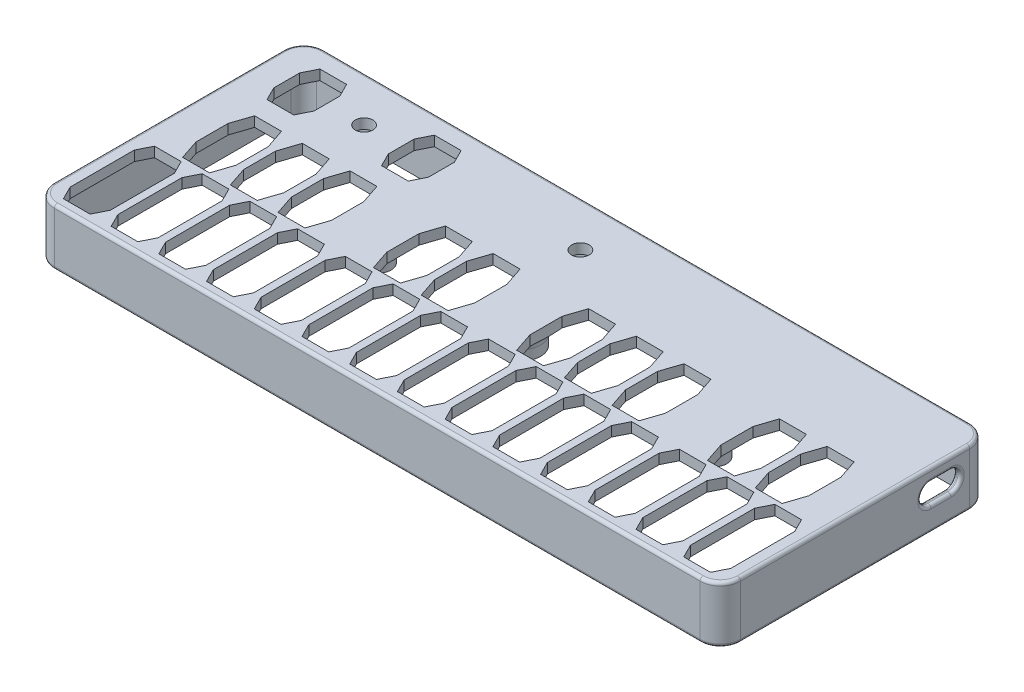
from build123d import *

# Parameters (mm, degrees)
SKETCH1_W           = 267.97
SKETCH1_H           = 101.6
BOSS_EXTRUDE1_DEPTH = 4
SKETCH3_R           = 3.5
CUT_EXTRUDE2_DEPTH  = 4
FILLET1_R           = 5.08
SKETCH4_R           = 5.08
SKETCH4_R_2         = 1.27
SKETCH4_R_3         = 7.62
BOSS_EXTRUDE2_DEPTH = 9
FILLET2_R           = 5.08
BOSS_EXTRUDE3_DEPTH = 22.606
FILLET3_R           = 1.27
USB_HOLE_DEPTH      = 22.606
FILLET4_R           = 1.27


with BuildPart() as part:
    # Sketch1 → Boss-Extrude1 (new body)
    with BuildSketch(Plane(origin=(0, 0, 0), x_dir=(1, 0, 0), z_dir=(0, 1, 0))):
        Rectangle(SKETCH1_W, SKETCH1_H)
    extrude(amount=BOSS_EXTRUDE1_DEPTH)

    # Sketch3 → Cut-Extrude2 (cut)
    with BuildSketch(Plane(origin=(-72.682254047, 4, -171.677206238), x_dir=(1, 0, 0), z_dir=(0, 1, 0))):
        Polygon((-14.550168649, -175.551724153), (-14.550168649, -162.722688324), (-17.201188446, -154.769628934), (-27.934303461, -154.769628934), (-30.585323258, -162.722688324), (-30.585323258, -175.551724153), (-27.934303461, -183.504783543), (-17.201188446, -183.504783543), align=None)
        Polygon((-24.075168649, -216.221061509), (-24.075168649, -190.633350968), (-26.767029666, -185.249628934), (-37.418462241, -185.249628934), (-40.110323258, -190.633350968), (-40.110323258, -216.221061509), (-37.418462241, -221.604783543), (-26.767029666, -221.604783543), align=None)
        Polygon((-56.468462241, -185.249628934), (-59.160323258, -190.633350968), (-59.160323258, -216.221061509), (-56.468462241, -221.604783543), (-45.817029666, -221.604783543), (-43.125168649, -216.221061509), (-43.125168649, -190.633350968), (-45.817029666, -185.249628934), align=None)
        Polygon((-5.025168649, -216.221061509), (-5.025168649, -190.633350968), (-7.717029666, -185.249628934), (-18.368462241, -185.249628934), (-21.060323258, -190.633350968), (-21.060323258, -216.221061509), (-18.368462241, -221.604783543), (-7.717029666, -221.604783543), align=None)
        Polygon((14.024831351, -216.221061509), (14.024831351, -190.633350968), (11.332970334, -185.249628934), (0.681537759, -185.249628934), (-2.010323258, -190.633350968), (-2.010323258, -216.221061509), (0.681537759, -221.604783543), (11.332970334, -221.604783543), align=None)
        Polygon((33.074831351, -216.221061509), (33.074831351, -190.633350968), (30.382970334, -185.249628934), (19.731537759, -185.249628934), (17.039676742, -190.633350968), (17.039676742, -216.221061509), (19.731537759, -221.604783543), (30.382970334, -221.604783543), align=None)
        Polygon((52.124831351, -216.221061509), (52.124831351, -190.633350968), (49.432970334, -185.249628934), (38.781537759, -185.249628934), (36.089676742, -190.633350968), (36.089676742, -216.221061509), (38.781537759, -221.604783543), (49.432970334, -221.604783543), align=None)
        Polygon((71.174831351, -216.221061509), (71.174831351, -190.633350968), (68.482970334, -185.249628934), (57.831537759, -185.249628934), (55.139676742, -190.633350968), (55.139676742, -216.221061509), (57.831537759, -221.604783543), (68.482970334, -221.604783543), align=None)
        Polygon((90.224831351, -216.221061509), (90.224831351, -190.633350968), (87.532970334, -185.249628934), (76.881537759, -185.249628934), (74.189676742, -190.633350968), (74.189676742, -216.221061509), (76.881537759, -221.604783543), (87.532970334, -221.604783543), align=None)
        Polygon((109.274831351, -216.221061509), (109.274831351, -190.633350968), (106.582970334, -185.249628934), (95.931537759, -185.249628934), (93.239676742, -190.633350968), (93.239676742, -216.221061509), (95.931537759, -221.604783543), (106.582970334, -221.604783543), align=None)
        Polygon((128.324831351, -216.221061509), (128.324831351, -190.633350968), (125.632970334, -185.249628934), (114.981537759, -185.249628934), (112.289676742, -190.633350968), (112.289676742, -216.221061509), (114.981537759, -221.604783543), (125.632970334, -221.604783543), align=None)
        Polygon((147.374831351, -216.221061509), (147.374831351, -190.633350968), (144.682970334, -185.249628934), (134.031537759, -185.249628934), (131.339676742, -190.633350968), (131.339676742, -216.221061509), (134.031537759, -221.604783543), (144.682970334, -221.604783543), align=None)
        Polygon((166.424831351, -216.221061509), (166.424831351, -190.633350968), (163.732970334, -185.249628934), (153.081537759, -185.249628934), (150.389676742, -190.633350968), (150.389676742, -216.221061509), (153.081537759, -221.604783543), (163.732970334, -221.604783543), align=None)
        Polygon((185.474831351, -216.221061509), (185.474831351, -190.633350968), (182.782970334, -185.249628934), (172.131537759, -185.249628934), (169.439676742, -190.633350968), (169.439676742, -216.221061509), (172.131537759, -221.604783543), (182.782970334, -221.604783543), align=None)
        Polygon((204.524831351, -216.221061509), (204.524831351, -190.633350968), (201.832970334, -185.249628934), (191.181537759, -185.249628934), (188.489676742, -190.633350968), (188.489676742, -216.221061509), (191.181537759, -221.604783543), (201.832970334, -221.604783543), align=None)
        Polygon((-36.251188446, -183.504783543), (-33.600168649, -175.551724153), (-33.600168649, -162.722688324), (-36.251188446, -154.769628934), (-46.984303461, -154.769628934), (-49.635323258, -162.722688324), (-49.635323258, -175.551724153), (-46.984303461, -183.504783543), align=None)
        Polygon((4.499831351, -175.551724153), (4.499831351, -162.722688324), (1.848811554, -154.769628934), (-8.884303461, -154.769628934), (-11.535323258, -162.722688324), (-11.535323258, -175.551724153), (-8.884303461, -183.504783543), (1.848811554, -183.504783543), align=None)
        Polygon((42.599831351, -175.551724153), (42.599831351, -162.722688324), (39.948811554, -154.769628934), (29.215696539, -154.769628934), (26.564676742, -162.722688324), (26.564676742, -175.551724153), (29.215696539, -183.504783543), (39.948811554, -183.504783543), align=None)
        Polygon((61.649831351, -175.551724153), (61.649831351, -162.722688324), (58.998811554, -154.769628934), (48.265696539, -154.769628934), (45.614676742, -162.722688324), (45.614676742, -175.551724153), (48.265696539, -183.504783543), (58.998811554, -183.504783543), align=None)
        Polygon((-39.467029666, -146.674783543), (-36.775168649, -141.291061509), (-36.775168649, -130.943350968), (-39.467029666, -125.559628934), (-50.118462241, -125.559628934), (-52.810323258, -130.943350968), (-52.810323258, -141.291061509), (-50.118462241, -146.674783543), align=None)
        Polygon((6.252970334, -146.674783543), (8.944831351, -141.291061509), (8.944831351, -130.943350968), (6.252970334, -125.559628934), (-4.398462241, -125.559628934), (-7.090323258, -130.943350968), (-7.090323258, -141.291061509), (-4.398462241, -146.674783543), align=None)
        Polygon((99.749831351, -175.551724153), (99.749831351, -162.722688324), (97.098811554, -154.769628934), (86.365696539, -154.769628934), (83.714676742, -162.722688324), (83.714676742, -175.551724153), (86.365696539, -183.504783543), (97.098811554, -183.504783543), align=None)
        Polygon((118.799831351, -175.551724153), (118.799831351, -162.722688324), (116.148811554, -154.769628934), (105.415696539, -154.769628934), (102.764676742, -162.722688324), (102.764676742, -175.551724153), (105.415696539, -183.504783543), (116.148811554, -183.504783543), align=None)
        Polygon((137.849831351, -175.551724153), (137.849831351, -162.722688324), (135.198811554, -154.769628934), (124.465696539, -154.769628934), (121.814676742, -162.722688324), (121.814676742, -175.551724153), (124.465696539, -183.504783543), (135.198811554, -183.504783543), align=None)
        Polygon((175.949831351, -175.551724153), (175.949831351, -162.722688324), (173.298811554, -154.769628934), (162.565696539, -154.769628934), (159.914676742, -162.722688324), (159.914676742, -175.551724153), (162.565696539, -183.504783543), (173.298811554, -183.504783543), align=None)
        Polygon((194.999831351, -175.551724153), (194.999831351, -162.722688324), (192.348811554, -154.769628934), (181.615696539, -154.769628934), (178.964676742, -162.722688324), (178.964676742, -175.551724153), (181.615696539, -183.504783543), (192.348811554, -183.504783543), align=None)
        with Locations(Location((64.427254047, -136.117206238, 0), (0, 0, 270))):
            Circle(SKETCH3_R)
        with Locations(Location((-21.932745953, -136.117206238, 0), (0, 0, 270))):
            Circle(SKETCH3_R)
    extrude(amount=-CUT_EXTRUDE2_DEPTH, mode=Mode.SUBTRACT)

    # Fillet1
    fillet1_edges = [part.edges().sort_by_distance(p)[0] for p in [
        (133.985, 2, 50.8),
        (-133.985, 2, 50.8),
        (-133.985, 2, -50.8),
        (133.985, 2, -50.8),
    ]]
    fillet(fillet1_edges, radius=FILLET1_R)

    # Sketch4 → Boss-Extrude2 (add)
    # profile 1 of 3: a face of its own
    with BuildSketch(Plane(origin=(0, 0, 0), x_dir=(-1, 0, 0), z_dir=(0, -1, 0))):
        with Locations(Location((57.15, 3.81, 0), (0, 0, 270))):
            Circle(SKETCH4_R)
        with Locations(Location((57.15, 3.81, 0), (0, 0, 90))):
            Circle(SKETCH4_R_2, mode=Mode.SUBTRACT)
    # profile 2 of 3: a face of its own
    with BuildSketch(Plane(origin=(0, 0, 0), x_dir=(-1, 0, 0), z_dir=(0, -1, 0))):
        with Locations(Location((-76.835, 3.81, 0), (0, 0, 270))):
            Circle(SKETCH4_R)
        with Locations(Location((-76.835, 3.81, 0), (0, 0, 90))):
            Circle(SKETCH4_R_2, mode=Mode.SUBTRACT)
    # profile 3 of 3: a face of its own
    with BuildSketch(Plane(origin=(0, 0, 0), x_dir=(-1, 0, 0), z_dir=(0, -1, 0))):
        with Locations(Location((0, 3.81, 0), (0, 0, 270))):
            Circle(SKETCH4_R_3)
    extrude(amount=BOSS_EXTRUDE2_DEPTH)

    # Fillet2
    # the kernel refuses this fillet: 5.08 mm, written as the material it adds along each edge
    with BuildSketch(Plane(origin=(-57.15, 0, -3.81), x_dir=(0, 0, 1), z_dir=(1, 0, 0))) as fillet2_piece_1:
        with BuildLine():
            CenterArc((5.08 + FILLET2_R, FILLET2_R), FILLET2_R, 180, 90)
            Line((5.08, FILLET2_R), (5.08, 0))
            Line((5.08, 0), (5.08 + FILLET2_R, 0))
        make_face()
    revolve(axis=Axis((-57.15, 0, -3.81), (0, -1, 0)))
    with BuildSketch(Plane(origin=(76.835, 0, -3.81), x_dir=(0, 0, 1), z_dir=(1, 0, 0))) as fillet2_piece_2:
        with BuildLine():
            CenterArc((5.08 + FILLET2_R, FILLET2_R), FILLET2_R, 180, 90)
            Line((5.08, FILLET2_R), (5.08, 0))
            Line((5.08, 0), (5.08 + FILLET2_R, 0))
        make_face()
    revolve(axis=Axis((76.835, 0, -3.81), (0, -1, 0)))
    with BuildSketch(Plane(origin=(0, 0, -3.81), x_dir=(0, 0, 1), z_dir=(1, 0, 0))) as fillet2_piece_3_section:
        with BuildLine():
            CenterArc((7.62 + FILLET2_R, FILLET2_R), FILLET2_R, 180, 90)
            Line((7.62, FILLET2_R), (7.62, 0))
            Line((7.62, 0), (7.62 + FILLET2_R, 0))
        make_face()
    fillet2_piece_3 = revolve(axis=Axis((0, 0, -3.81), (0, -1, 0)), mode=Mode.PRIVATE)
    fillet2_piece_3 = split(fillet2_piece_3, bisect_by=Plane(origin=(11.032422696, -1.439568493, -12.869568493), z_dir=(-1, 0, 0)), keep=Keep.TOP, mode=Mode.PRIVATE)
    fillet2_piece_3 = split(fillet2_piece_3, bisect_by=Plane(origin=(11.1036956, -1.439568493, -9.168336627), z_dir=(-0.9486832980505142, -1.1041033438718387e-15, -0.31622776601683694)), keep=Keep.TOP, mode=Mode.PRIVATE)
    fillet2_piece_3 = split(fillet2_piece_3, bisect_by=Plane(origin=(-11.032422696, -1.439568493, -12.869568493), z_dir=(1, 0, 0)), keep=Keep.TOP, mode=Mode.PRIVATE)
    fillet2_piece_3 = split(fillet2_piece_3, bisect_by=Plane(origin=(-11.1036956, -1.439568493, -9.168336627), z_dir=(0.9486832980505139, -1.1041033438718415e-15, -0.31622776601683766)), keep=Keep.TOP, mode=Mode.PRIVATE)
    add(fillet2_piece_3)
    with BuildSketch(Plane(origin=(0, 0, -3.81), x_dir=(0, 0, 1), z_dir=(1, 0, 0))) as fillet2_piece_4_section:
        with BuildLine():
            CenterArc((7.62 + FILLET2_R, FILLET2_R), FILLET2_R, 180, 90)
            Line((7.62, FILLET2_R), (7.62, 0))
            Line((7.62, 0), (7.62 + FILLET2_R, 0))
        make_face()
    fillet2_piece_4 = revolve(axis=Axis((0, 0, -3.81), (0, -1, 0)), mode=Mode.PRIVATE)
    fillet2_piece_4 = split(fillet2_piece_4, bisect_by=Plane(origin=(11.032422696, -0.33089654, -0.32683525), z_dir=(-1, 0, 0)), keep=Keep.TOP, mode=Mode.PRIVATE)
    fillet2_piece_4 = split(fillet2_piece_4, bisect_by=Plane(origin=(8.248963415, -0.33089654, -0.604140073), z_dir=(0.9486832980505142, 1.1041033438718387e-15, 0.31622776601683694)), keep=Keep.TOP, mode=Mode.PRIVATE)
    add(fillet2_piece_4)
    with BuildSketch(Plane(origin=(0, 0, -3.81), x_dir=(0, 0, 1), z_dir=(1, 0, 0))) as fillet2_piece_5_section:
        with BuildLine():
            CenterArc((7.62 + FILLET2_R, FILLET2_R), FILLET2_R, 180, 90)
            Line((7.62, FILLET2_R), (7.62, 0))
            Line((7.62, 0), (7.62 + FILLET2_R, 0))
        make_face()
    fillet2_piece_5 = revolve(axis=Axis((0, 0, -3.81), (0, -1, 0)), mode=Mode.PRIVATE)
    fillet2_piece_5 = split(fillet2_piece_5, bisect_by=Plane(origin=(11.032422696, 0.048288116, -9.564633075), z_dir=(1, 0, 0)), keep=Keep.TOP, mode=Mode.PRIVATE)
    fillet2_piece_5 = split(fillet2_piece_5, bisect_by=Plane(origin=(11.223241222, 0.048288116, -9.526973492), z_dir=(-0.9486832980505142, -1.1041033438718387e-15, -0.31622776601683694)), keep=Keep.TOP, mode=Mode.PRIVATE)
    add(fillet2_piece_5)
    with BuildSketch(Plane(origin=(0, 0, -3.81), x_dir=(0, 0, 1), z_dir=(1, 0, 0))) as fillet2_piece_6_section:
        with BuildLine():
            CenterArc((7.62 + FILLET2_R, FILLET2_R), FILLET2_R, 180, 90)
            Line((7.62, FILLET2_R), (7.62, 0))
            Line((7.62, 0), (7.62 + FILLET2_R, 0))
        make_face()
    fillet2_piece_6 = revolve(axis=Axis((0, 0, -3.81), (0, -1, 0)), mode=Mode.PRIVATE)
    fillet2_piece_6 = split(fillet2_piece_6, bisect_by=Plane(origin=(-11.032422696, 0.048288025, -9.56463281), z_dir=(-1, 0, 0)), keep=Keep.TOP, mode=Mode.PRIVATE)
    fillet2_piece_6 = split(fillet2_piece_6, bisect_by=Plane(origin=(-11.223241139, 0.048288025, -9.526973243), z_dir=(0.9486832980505139, -1.1041033438718415e-15, -0.31622776601683766)), keep=Keep.TOP, mode=Mode.PRIVATE)
    add(fillet2_piece_6)
    with BuildSketch(Plane(origin=(0, 0, -3.81), x_dir=(0, 0, 1), z_dir=(1, 0, 0))) as fillet2_piece_7_section:
        with BuildLine():
            CenterArc((7.62 + FILLET2_R, FILLET2_R), FILLET2_R, 180, 90)
            Line((7.62, FILLET2_R), (7.62, 0))
            Line((7.62, 0), (7.62 + FILLET2_R, 0))
        make_face()
    fillet2_piece_7 = revolve(axis=Axis((0, 0, -3.81), (0, -1, 0)), mode=Mode.PRIVATE)
    fillet2_piece_7 = split(fillet2_piece_7, bisect_by=Plane(origin=(-11.032422696, -0.330898428, -0.326832587), z_dir=(1, 0, 0)), keep=Keep.TOP, mode=Mode.PRIVATE)
    fillet2_piece_7 = split(fillet2_piece_7, bisect_by=Plane(origin=(-8.248962302, -0.330898428, -0.604136732), z_dir=(-0.9486832980505139, 1.1041033438718415e-15, 0.31622776601683766)), keep=Keep.TOP, mode=Mode.PRIVATE)
    add(fillet2_piece_7)

    # Sketch6 → Boss-Extrude3 (add)
    with BuildSketch(Plane(origin=(0, 4, 0), x_dir=(1, 0, 0), z_dir=(0, 1, 0))):
        with BuildLine():
            Line((-136.985, 45.72), (-136.985, -45.72))
            ThreePointArc((-136.985, -45.72), (-134.618422792, -51.433422792), (-128.905, -53.8))
            Line((-128.905, -53.8), (128.905, -53.8))
            ThreePointArc((128.905, -53.8), (134.618422792, -51.433422792), (136.985, -45.72))
            Line((136.985, -45.72), (136.985, 45.72))
            ThreePointArc((136.985, 45.72), (134.618422792, 51.433422792), (128.905, 53.8))
            Line((128.905, 53.8), (-128.905, 53.8))
            ThreePointArc((-128.905, 53.8), (-134.618422792, 51.433422792), (-136.985, 45.72))
        make_face()
        with BuildLine():
            Line((-133.985, 45.72), (-133.985, -45.72))
            ThreePointArc((-133.985, -45.72), (-132.497102448, -49.312102448), (-128.905, -50.8))
            Line((-128.905, -50.8), (128.905, -50.8))
            ThreePointArc((128.905, -50.8), (132.497102448, -49.312102448), (133.985, -45.72))
            Line((133.985, -45.72), (133.985, 45.72))
            ThreePointArc((133.985, 45.72), (132.497102448, 49.312102448), (128.905, 50.8))
            Line((128.905, 50.8), (-128.905, 50.8))
            ThreePointArc((-128.905, 50.8), (-132.497102448, 49.312102448), (-133.985, 45.72))
        make_face(mode=Mode.SUBTRACT)
    extrude(amount=-BOSS_EXTRUDE3_DEPTH)

    # Fillet3
    fillet3_edges = [part.edges().sort_by_distance(p)[0] for p in [
        (-134.618422792, -18.606, -51.433422792),
        (0, -18.606, -53.8),
        (134.618422792, -18.606, -51.433422792),
        (136.985, -18.606, 0),
        (134.618422792, -18.606, 51.433422792),
        (0, -18.606, 53.8),
        (-134.618422792, -18.606, 51.433422792),
        (-136.985, -18.606, 0),
        (-134.618422792, 4, -51.433422792),
        (-136.985, 4, 0),
        (-134.618422792, 4, 51.433422792),
        (0, 4, 53.8),
        (134.618422792, 4, 51.433422792),
        (136.985, 4, 0),
        (134.618422792, 4, -51.433422792),
        (0, 4, -53.8),
    ]]
    fillet(fillet3_edges, radius=FILLET3_R)

    # Sketch7 → USB_Hole (cut)
    with BuildSketch(Plane.ZY.offset(-133.985)):
        with BuildLine():
            Line((-38.29, -1), (-30.29, -1))
            ThreePointArc((-30.29, -1), (-26.29, -5), (-30.29, -9))
            Line((-30.29, -9), (-38.29, -9))
            ThreePointArc((-38.29, -9), (-42.29, -5), (-38.29, -1))
        make_face()
    extrude(amount=-USB_HOLE_DEPTH, mode=Mode.SUBTRACT)

    # Fillet4
    fillet4_edges = [part.edges().sort_by_distance(p)[0] for p in [
        (136.985, -1, -34.29),
        (136.985, -5, -42.29),
        (136.985, -9, -34.29),
        (133.985, -9, -34.29),
        (133.985, -5, -42.29),
        (136.985, -5, -26.29),
        (133.985, -5, -26.29),
    ]]
    fillet(fillet4_edges, radius=FILLET4_R)


solid = part.part
